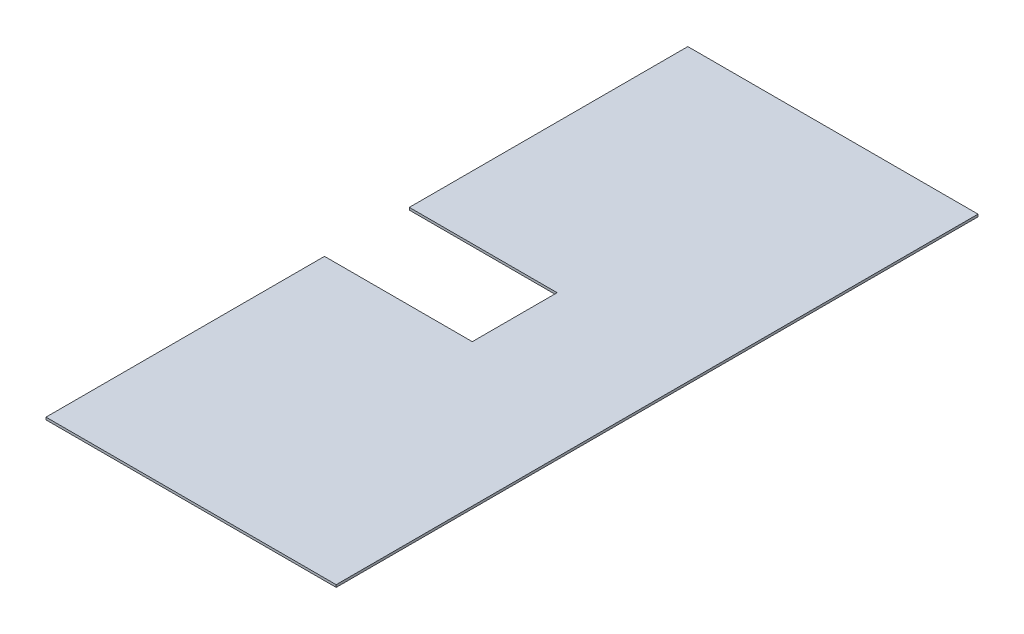
from build123d import *

# Parameters (mm, degrees)
SM_BASE_FLANGE_1_DEPTH = 3


# Sheet-metal steps are written as plain solids
with BuildPart() as part:
    # Эскиз3 → Базовая кромка1 (new body)
    with BuildSketch(Plane(origin=(-357.172117652, 0, 0), x_dir=(1, 0, 0), z_dir=(0, 1, 0))):
        Polygon((-5.425697168, 401), (357.172117652, 401), (357.172117652, -401), (-5.425697168, -401), (-5.425697168, -53), (179.2603216, -53), (179.2603216, 53), (-5.425697168, 53), align=None)
    extrude(amount=SM_BASE_FLANGE_1_DEPTH)


solid = part.part
